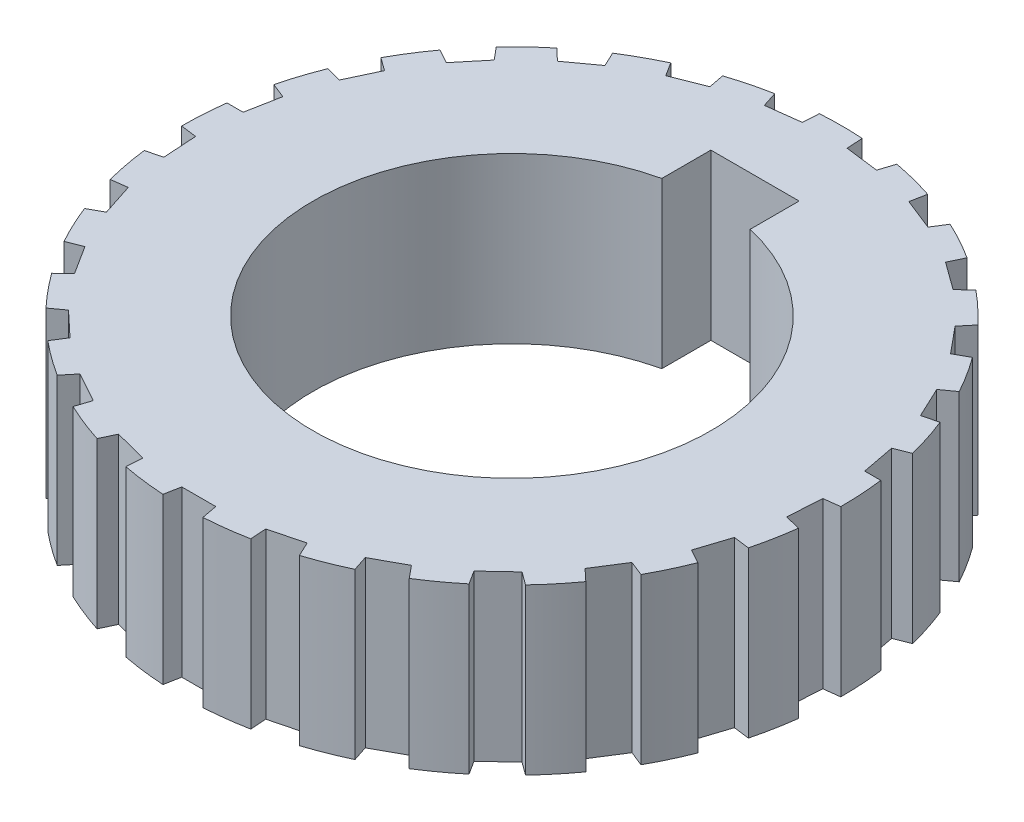
from build123d import *

# Parameters (mm, degrees)
SKETCH1_R           = 38.1
BOSS_EXTRUDE1_DEPTH = 19.05
CUT_EXTRUDE1_DEPTH  = 33
CIRPATTERN1_COUNT   = 25
CUT_EXTRUDE2_DEPTH  = 25.4


with BuildPart() as part:
    # Sketch1 → Boss-Extrude1 (new body)
    with BuildSketch(Plane(origin=(0, 0, 0), x_dir=(1, 0, 0), z_dir=(0, 1, 0))):
        Circle(SKETCH1_R)
    extrude(amount=BOSS_EXTRUDE1_DEPTH)

    # Sketch2 → Cut-Extrude1 (cut)
    with BuildSketch(Plane.XZ):
        Polygon((-1.965720517, 36.2), (1.965720517, 36.2), (2.3241, 38.105), (-2.3241, 38.105), align=None)
    cut_extrude1 = extrude(amount=-CUT_EXTRUDE1_DEPTH, mode=Mode.SUBTRACT)

    # CirPattern1: Cut-Extrude1 ×25 about axis
    cirpattern1_axis = Axis((0, 0, 0), (0, 1, 0))
    for i in range(1, CIRPATTERN1_COUNT):
        add(cut_extrude1.rotate(cirpattern1_axis, i * 360 / CIRPATTERN1_COUNT), mode=Mode.SUBTRACT)

    # Sketch3 → Cut-Extrude2 (cut)
    with BuildSketch(Plane(origin=(0, 19.05, 0), x_dir=(1, 0, 0), z_dir=(0, 1, 0))):
        with BuildLine():
            Line((-5.1, 28.1), (-5.1, 22.427438552))
            ThreePointArc((-5.1, 22.427438552), (0, -23), (5.1, 22.427438552))
            Line((5.1, 22.427438552), (5.1, 28.1))
            Line((5.1, 28.1), (-5.1, 28.1))
        make_face()
    extrude(amount=-CUT_EXTRUDE2_DEPTH, mode=Mode.SUBTRACT)


solid = part.part
